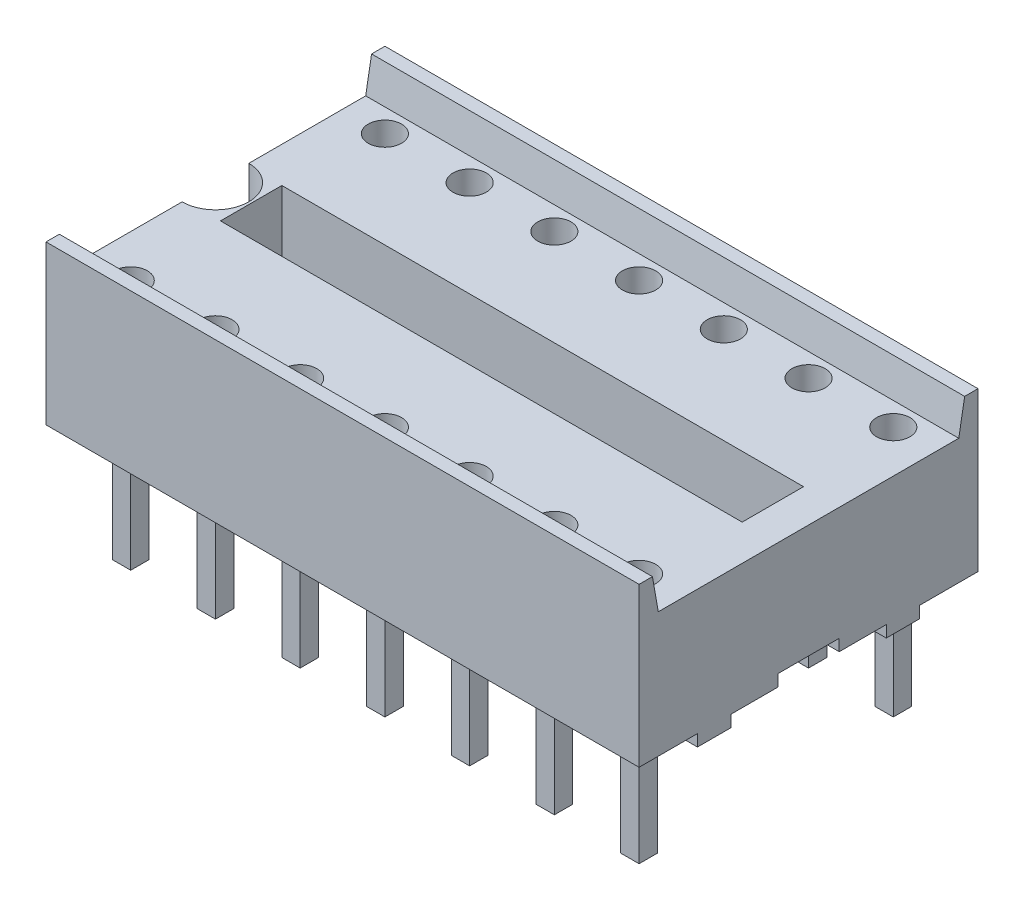
from build123d import *

# Parameters (mm, degrees)
SOCKET_HOUSING_DEPTH  = 17.78
SKETCH3_R             = 0.5
HOLES_DEPTH           = 3
SKETCH4_W             = 0.55
SKETCH4_H             = 0.55
PINS_DEPTH            = 3.5
LPATTERN3_START       = 16.235
LPATTERN3_OUTLINE_W   = 3.5
LPATTERN3_OUTLINE_H   = 0.55
LPATTERN3_DEPTH       = 0.55
LPATTERN3_START_2     = 13.695
LPATTERN3_2_OUTLINE_W = 3.5
LPATTERN3_2_OUTLINE_H = 0.55
LPATTERN3_2_DEPTH     = 0.55
LPATTERN3_START_3     = 11.155
LPATTERN3_3_OUTLINE_W = 3.5
LPATTERN3_3_OUTLINE_H = 0.55
LPATTERN3_3_DEPTH     = 0.55
LPATTERN3_START_4     = 8.615
LPATTERN3_4_OUTLINE_W = 3.5
LPATTERN3_4_OUTLINE_H = 0.55
LPATTERN3_4_DEPTH     = 0.55
LPATTERN3_START_5     = 6.075
LPATTERN3_5_OUTLINE_W = 3.5
LPATTERN3_5_OUTLINE_H = 0.55
LPATTERN3_5_DEPTH     = 0.55
LPATTERN3_START_6     = 3.535
LPATTERN3_6_OUTLINE_W = 3.5
LPATTERN3_6_OUTLINE_H = 0.55
LPATTERN3_6_DEPTH     = 0.55
LPATTERN3_START_7     = -3
LPATTERN3_7_OUTLINE_R = 0.5
LPATTERN3_7_DEPTH     = 3
MIRROR2_START         = -3
MIRROR2_OUTLINE_R     = 0.5
MIRROR2_DEPTH         = 3
MIRROR2_START_2       = -7.25
MIRROR2_2_OUTLINE_W   = 0.55
MIRROR2_2_OUTLINE_H   = 0.55
MIRROR2_2_DEPTH       = 3.5
SKETCH5_W             = 15.64
SKETCH5_H             = 1.84
CUT_EXTRUDE3_DEPTH    = 20.861956097


# Read off the part's stored shape, not the designer's step: LPattern3, Mirror2
with BuildPart() as part:
    # Sketch2 → socket_housing (new body)
    with BuildSketch(Plane(origin=(0, 0, 0), x_dir=(0, 0, -1), z_dir=(1, 0, 0))):
        Polygon((-5.08, -3.75), (-3.33, -3.75), (-3.33, -4.1), (-2.33, -4.1), (-2.33, -3.75), (-0.92, -3.75), (-0.92, -3.4), (0, -3.4), (0, 0), (-4.503673019, 0), (-4.68, 1), (-5.08, 1), align=None)
    socket_housing = extrude(amount=SOCKET_HOUSING_DEPTH)

    # Sketch3 → holes (cut)
    with BuildSketch(Plane(origin=(0, 0, 0), x_dir=(1, 0, 0), z_dir=(0, 1, 0))):
        with Locations(Location((1.27, -3.81, 0), (0, 0, 270))):
            Circle(SKETCH3_R)
    extrude(amount=-HOLES_DEPTH, mode=Mode.SUBTRACT)

    # LPattern3 7 outline → LPattern3 7 (cut)
    with BuildSketch(Plane(origin=(0, 0, 0), x_dir=(1, 0, 0), z_dir=(0, 1, 0)).offset(LPATTERN3_START_7)):
        with Locations((16.51, -3.81)):
            Circle(LPATTERN3_7_OUTLINE_R)
        with Locations((13.97, -3.81)):
            Circle(LPATTERN3_7_OUTLINE_R)
        with Locations((11.43, -3.81)):
            Circle(LPATTERN3_7_OUTLINE_R)
        with Locations((8.89, -3.81)):
            Circle(LPATTERN3_7_OUTLINE_R)
        with Locations((6.35, -3.81)):
            Circle(LPATTERN3_7_OUTLINE_R)
        with Locations((3.81, -3.81)):
            Circle(LPATTERN3_7_OUTLINE_R)
    extrude(amount=LPATTERN3_7_DEPTH, mode=Mode.SUBTRACT)

    # Mirror1: socket_housing across plane
    add(socket_housing.mirror(Plane.XY))

    # Mirror2 outline → Mirror2 (cut)
    with BuildSketch(Plane(origin=(0, 0, 0), x_dir=(1, 0, 0), z_dir=(0, 1, 0)).offset(MIRROR2_START)):
        with Locations((16.51, 3.81)):
            Circle(MIRROR2_OUTLINE_R)
        with Locations((13.97, 3.81)):
            Circle(MIRROR2_OUTLINE_R)
        with Locations((11.43, 3.81)):
            Circle(MIRROR2_OUTLINE_R)
        with Locations((8.89, 3.81)):
            Circle(MIRROR2_OUTLINE_R)
        with Locations((6.35, 3.81)):
            Circle(MIRROR2_OUTLINE_R)
        with Locations((3.81, 3.81)):
            Circle(MIRROR2_OUTLINE_R)
        with Locations((1.27, 3.81)):
            Circle(MIRROR2_OUTLINE_R)
    extrude(amount=MIRROR2_DEPTH, mode=Mode.SUBTRACT)

    # Mirror2 2 outline → Mirror2 2 (add)
    with BuildSketch(Plane(origin=(0, 0, 0), x_dir=(1, 0, 0), z_dir=(0, 1, 0)).offset(MIRROR2_START_2)):
        with Locations((16.51, 3.81)):
            Rectangle(MIRROR2_2_OUTLINE_W, MIRROR2_2_OUTLINE_H)
        with Locations((13.97, 3.81)):
            Rectangle(MIRROR2_2_OUTLINE_W, MIRROR2_2_OUTLINE_H)
        with Locations((11.43, 3.81)):
            Rectangle(MIRROR2_2_OUTLINE_W, MIRROR2_2_OUTLINE_H)
        with Locations((8.89, 3.81)):
            Rectangle(MIRROR2_2_OUTLINE_W, MIRROR2_2_OUTLINE_H)
        with Locations((6.35, 3.81)):
            Rectangle(MIRROR2_2_OUTLINE_W, MIRROR2_2_OUTLINE_H)
        with Locations((3.81, 3.81)):
            Rectangle(MIRROR2_2_OUTLINE_W, MIRROR2_2_OUTLINE_H)
        with Locations((1.27, 3.81)):
            Rectangle(MIRROR2_2_OUTLINE_W, MIRROR2_2_OUTLINE_H)
    extrude(amount=MIRROR2_2_DEPTH)

    # Sketch5 → Cut-Extrude3 (cut, through all)
    with BuildSketch(Plane(origin=(0, 0, 0), x_dir=(1, 0, 0), z_dir=(0, 1, 0))):
        with BuildLine():
            Line((0, 1), (0, -1))
            ThreePointArc((0, -1), (1, 0), (0, 1))
        make_face()
        with Locations((8.89, 0)):
            Rectangle(SKETCH5_W, SKETCH5_H)
    extrude(amount=-CUT_EXTRUDE3_DEPTH, mode=Mode.SUBTRACT)


with BuildPart() as body_2:
    # Sketch4 → pins (new body)
    with BuildSketch(Plane.XZ.offset(3.75)):
        with Locations((1.27, 3.81)):
            Rectangle(SKETCH4_W, SKETCH4_H)
    extrude(amount=PINS_DEPTH)


with BuildPart() as body_3:
    # LPattern3 outline → LPattern3 (new body)
    with BuildSketch(Plane.YZ.offset(LPATTERN3_START)):
        with Locations((-5.5, 3.81)):
            Rectangle(LPATTERN3_OUTLINE_W, LPATTERN3_OUTLINE_H)
    extrude(amount=LPATTERN3_DEPTH)


with BuildPart() as body_4:
    # LPattern3 2 outline → LPattern3 2 (new body)
    with BuildSketch(Plane.YZ.offset(LPATTERN3_START_2)):
        with Locations((-5.5, 3.81)):
            Rectangle(LPATTERN3_2_OUTLINE_W, LPATTERN3_2_OUTLINE_H)
    extrude(amount=LPATTERN3_2_DEPTH)


with BuildPart() as body_5:
    # LPattern3 3 outline → LPattern3 3 (new body)
    with BuildSketch(Plane.YZ.offset(LPATTERN3_START_3)):
        with Locations((-5.5, 3.81)):
            Rectangle(LPATTERN3_3_OUTLINE_W, LPATTERN3_3_OUTLINE_H)
    extrude(amount=LPATTERN3_3_DEPTH)


with BuildPart() as body_6:
    # LPattern3 4 outline → LPattern3 4 (new body)
    with BuildSketch(Plane.YZ.offset(LPATTERN3_START_4)):
        with Locations((-5.5, 3.81)):
            Rectangle(LPATTERN3_4_OUTLINE_W, LPATTERN3_4_OUTLINE_H)
    extrude(amount=LPATTERN3_4_DEPTH)


with BuildPart() as body_7:
    # LPattern3 5 outline → LPattern3 5 (new body)
    with BuildSketch(Plane.YZ.offset(LPATTERN3_START_5)):
        with Locations((-5.5, 3.81)):
            Rectangle(LPATTERN3_5_OUTLINE_W, LPATTERN3_5_OUTLINE_H)
    extrude(amount=LPATTERN3_5_DEPTH)


with BuildPart() as body_8:
    # LPattern3 6 outline → LPattern3 6 (new body)
    with BuildSketch(Plane.YZ.offset(LPATTERN3_START_6)):
        with Locations((-5.5, 3.81)):
            Rectangle(LPATTERN3_6_OUTLINE_W, LPATTERN3_6_OUTLINE_H)
    extrude(amount=LPATTERN3_6_DEPTH)


solid = Compound([part.part, body_2.part, body_3.part, body_4.part, body_5.part, body_6.part, body_7.part, body_8.part])
